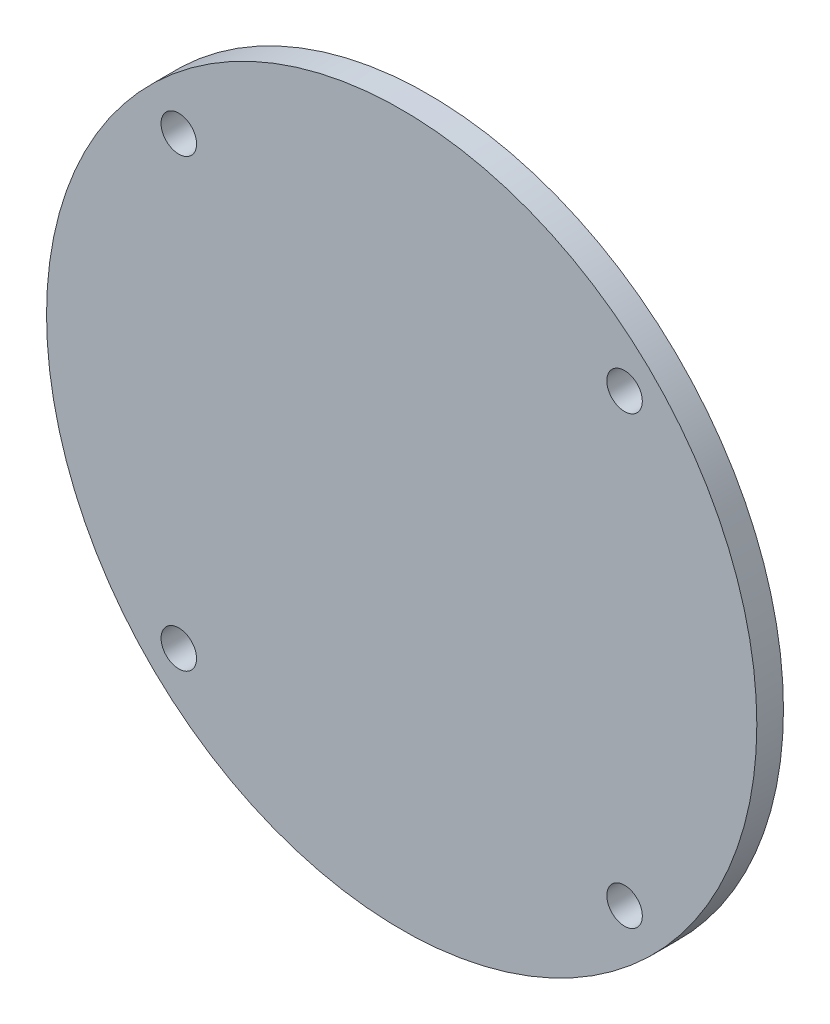
from build123d import *

# Parameters (mm, degrees)
SKETCH_1_R      = 40
SKETCH_1_R_2    = 2
EXTRUDE_1_DEPTH = 3


with BuildPart() as part:
    # 草图1 → 凸台-拉伸1 (new body)
    with BuildSketch(Plane.XY):
        Circle(SKETCH_1_R)
        with Locations((-25.102290732, -25.102290732)):
            Circle(SKETCH_1_R_2, mode=Mode.SUBTRACT)
        with Locations((-25.102290732, 25.102290732)):
            Circle(SKETCH_1_R_2, mode=Mode.SUBTRACT)
        with Locations((25.102290732, 25.102290732)):
            Circle(SKETCH_1_R_2, mode=Mode.SUBTRACT)
        with Locations((25.102290732, -25.102290732)):
            Circle(SKETCH_1_R_2, mode=Mode.SUBTRACT)
    extrude(amount=EXTRUDE_1_DEPTH)


solid = part.part
